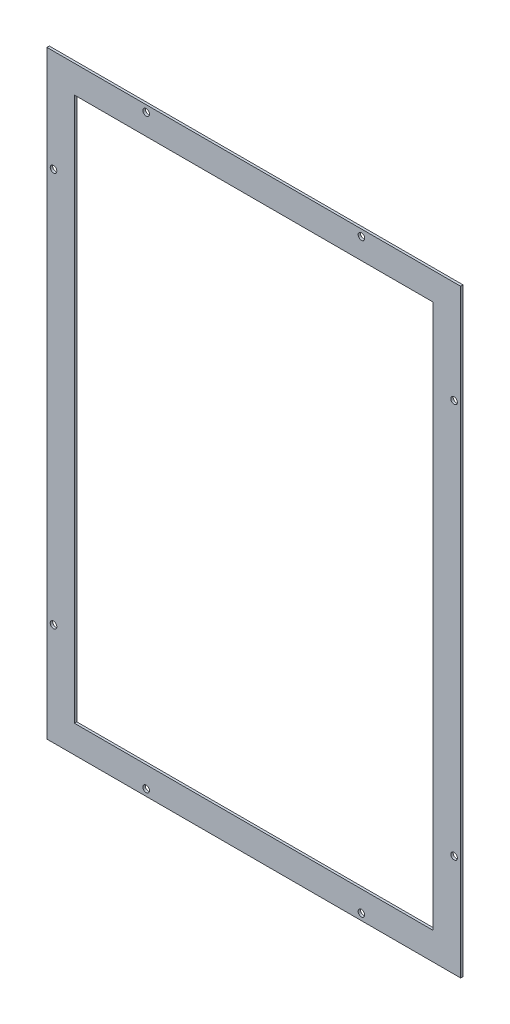
from build123d import *

# Parameters (mm, degrees)
IZIM1_W               = 346
IZIM1_H               = 501
IZIM1_W_2             = 300
IZIM1_H_2             = 455
TABAN_FLAN_1_DEPTH    = 2
IZIM2_R               = 2.75
KES_EKSTR_ZYON1_DEPTH = 10


# Sheet-metal steps are written as plain solids
with BuildPart() as part:
    # Çizim1 → Taban-Flanş1 (new body)
    with BuildSketch(Plane.XY):
        with Locations((0, -227.5)):
            Rectangle(IZIM1_W, IZIM1_H)
        with Locations((0, -227.5)):
            Rectangle(IZIM1_W_2, IZIM1_H_2, mode=Mode.SUBTRACT)
    extrude(amount=-TABAN_FLAN_1_DEPTH)

    # Çizim2 → Kes-Ekstrüzyon1 (cut)
    with BuildSketch(Plane.XY):
        with Locations((90, 17.5)):
            Circle(IZIM2_R)
        with Locations((-90, 17.5)):
            Circle(IZIM2_R)
        with Locations((-167.5, -62.5)):
            Circle(IZIM2_R)
        with Locations((-167.5, -392.5)):
            Circle(IZIM2_R)
        with Locations(Location((167.5, -392.5, 0), (0, 0, 180))):
            Circle(IZIM2_R)
        with Locations(Location((167.5, -62.5, 0), (0, 0, 180))):
            Circle(IZIM2_R)
        with Locations(Location((90, -472.5, 0), (0, 0, 180))):
            Circle(IZIM2_R)
        with Locations(Location((-90, -472.5, 0), (0, 0, 180))):
            Circle(IZIM2_R)
    extrude(amount=-KES_EKSTR_ZYON1_DEPTH, mode=Mode.SUBTRACT)


solid = part.part
